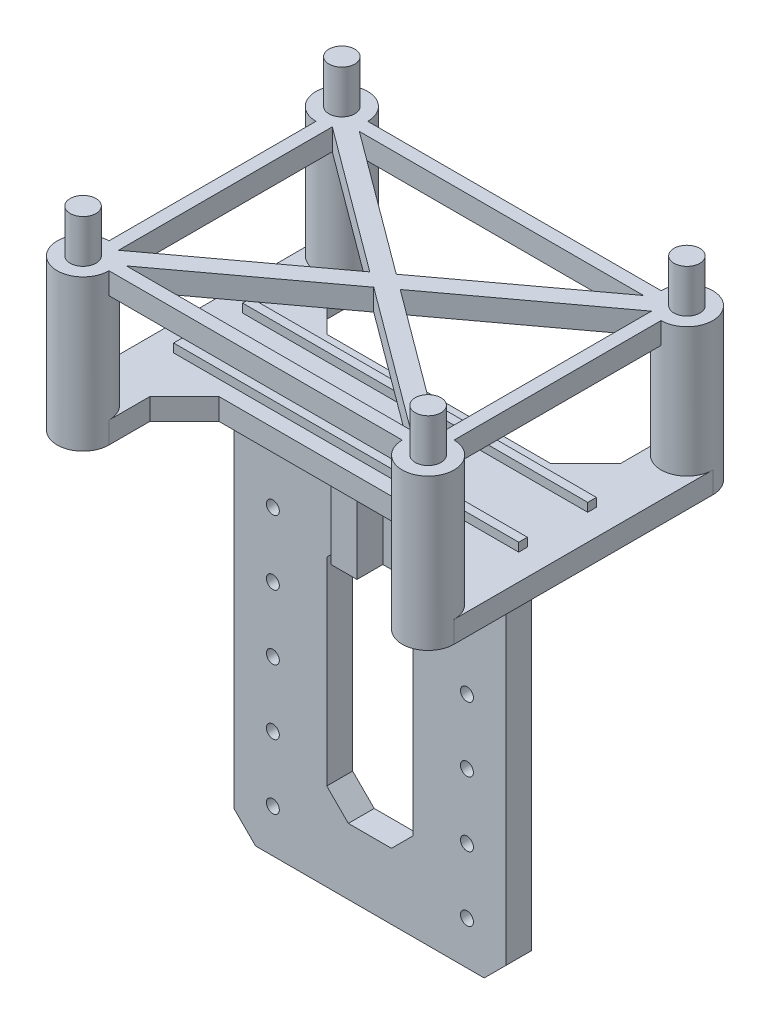
from build123d import *
from build123d.topology import SkipClean

# Parameters (mm, degrees)
SKETCH_1_W          = 87.411285366
SKETCH_1_H          = 25
EXTRUDE_1_DEPTH     = 3
SKETCH_2_R          = 1.5
CUT_EXTRUDE_1_DEPTH = 9
EXTRUDE_3_DEPTH     = 3
SKETCH_4_W          = 12
SKETCH_4_H          = 60
EXTRUDE_4_DEPTH     = 3
EXTRUDE_START       = 30
SKETCH_5_R          = 6
EXTRUDE_5_DEPTH     = 30
SKETCH_7_W          = 80
SKETCH_7_H          = 2
EXTRUDE_7_DEPTH     = 2
SKETCH_8_R          = 3
EXTRUDE_8_DEPTH     = 10
CHAMFER_1_SIZE      = 8
SKETCH_9_W          = 80
SKETCH_9_H          = 60
EXTRUDE_9_DEPTH     = 5
SKETCH_10_R         = 1.5
EXTRUDE_11_DEPTH    = 2
EXTRUDE_START_2     = -5
EXTRUDE_13_DEPTH    = 95
SKETCH_14_R         = 1.5
CUT_EXTRUDE_2_DEPTH = 90
SKETCH_20_W         = 10
SKETCH_20_H         = 55.969935275
CUT_EXTRUDE_3_DEPTH = 111.182802651
CHAMFER_2_SIZE      = 5
EXTRUDE_16_DEPTH    = 6
SKETCH_23_W         = 63
SKETCH_23_H         = 90
CUT_EXTRUDE_4_DEPTH = 1
CHAMFER_3_SIZE      = 5
CHAMFER_4_SIZE      = 5


with BuildPart() as part:
    # 草图1 → 凸台-拉伸1 (new body)
    with BuildSketch(Plane(origin=(0, 0, 0), x_dir=(1, 0, 0), z_dir=(0, 1, 0))):
        Rectangle(SKETCH_1_W, SKETCH_1_H)
    extrude(amount=EXTRUDE_1_DEPTH)

    # 草图2 → 切除-拉伸1 (cut)
    with BuildSketch(Plane.XZ):
        with Locations(Location((30, 0, 0), (0, 0, 270))):
            Circle(SKETCH_2_R)
        with Locations(Location((-30, 0, 0), (0, 0, 270))):
            Circle(SKETCH_2_R)
    extrude(amount=-CUT_EXTRUDE_1_DEPTH, mode=Mode.SUBTRACT)

    # 草图3 → 凸台-拉伸3 (add)
    with BuildSketch(Plane(origin=(0, 3, 0), x_dir=(1, 0, 0), z_dir=(0, 1, 0))):
        with BuildLine():
            Line((-43.705642683, 12.5), (-35.720877619, 12.5))
            Line((-35.720877619, 12.5), (-35.720877619, 25.794157439))
            ThreePointArc((-35.720877619, 25.794157439), (-40.384749305, 35.98765129), (-43.705642683, 25.281079328))
            Line((-43.705642683, 25.281079328), (-43.705642683, 12.5))
        make_face()
        with BuildLine():
            Line((35.720877619, 12.5), (43.705642683, 12.5))
            Line((43.705642683, 12.5), (43.705642683, 25.281079328))
            ThreePointArc((43.705642683, 25.281079328), (40.384749305, 35.98765129), (35.720877619, 25.794157439))
            Line((35.720877619, 25.794157439), (35.720877619, 12.5))
        make_face()
        with BuildLine():
            Line((43.705642683, -25.281079328), (43.705642683, -12.5))
            Line((43.705642683, -12.5), (35.720877619, -12.5))
            Line((35.720877619, -12.5), (35.720877619, -25.794157439))
            ThreePointArc((35.720877619, -25.794157439), (40.384749305, -35.98765129), (43.705642683, -25.281079328))
        make_face()
        with BuildLine():
            Line((-35.720877619, -25.794157439), (-35.720877619, -12.5))
            Line((-35.720877619, -12.5), (-43.705642683, -12.5))
            Line((-43.705642683, -12.5), (-43.705642683, -25.281079328))
            ThreePointArc((-43.705642683, -25.281079328), (-40.384749305, -35.98765129), (-35.720877619, -25.794157439))
        make_face()
    extrude(amount=-EXTRUDE_3_DEPTH)

    # 草图4 → 凸台-拉伸4 (add)
    with BuildSketch(Plane(origin=(0, 3, 0), x_dir=(1, 0, 0), z_dir=(0, 1, 0))):
        with Locations((40, 0)):
            Rectangle(SKETCH_4_W, SKETCH_4_H)
        with Locations((-40, 0)):
            Rectangle(SKETCH_4_W, SKETCH_4_H)
    extrude(amount=-EXTRUDE_4_DEPTH)

    # 草图5 → 凸台-拉伸5 (add)
    with BuildSketch(Plane(origin=(0, 3, 0), x_dir=(1, 0, 0), z_dir=(0, 1, 0)).offset(EXTRUDE_START)):
        with Locations(Location((40, 30, 0), (0, 0, 270))):
            Circle(SKETCH_5_R)
        with Locations(Location((40, -30, 0), (0, 0, 270))):
            Circle(SKETCH_5_R)
        with Locations(Location((-40, -30, 0), (0, 0, 270))):
            Circle(SKETCH_5_R)
        with Locations(Location((-40, 30, 0), (0, 0, 270))):
            Circle(SKETCH_5_R)
    extrude(amount=-EXTRUDE_5_DEPTH)

    # 草图7 → 凸台-拉伸7 (add)
    with BuildSketch(Plane(origin=(0, 3, 0), x_dir=(1, 0, 0), z_dir=(0, 1, 0))):
        with Locations((0, -8)):
            Rectangle(SKETCH_7_W, SKETCH_7_H)
        with Locations((0, 8)):
            Rectangle(SKETCH_7_W, SKETCH_7_H)
    extrude(amount=EXTRUDE_7_DEPTH)

    # 草图8 → 凸台-拉伸8 (add)
    with BuildSketch(Plane(origin=(0, 33, 0), x_dir=(1, 0, 0), z_dir=(0, 1, 0))):
        with Locations(Location((-40, -30, 0), (0, 0, 270))):
            Circle(SKETCH_8_R)
        with Locations(Location((-40, 30, 0), (0, 0, 270))):
            Circle(SKETCH_8_R)
        with Locations(Location((40, 30, 0), (0, 0, 270))):
            Circle(SKETCH_8_R)
        with Locations(Location((40, -30, 0), (0, 0, 270))):
            Circle(SKETCH_8_R)
    extrude(amount=EXTRUDE_8_DEPTH)

    # 倒角1
    chamfer_1_edges = [part.edges().sort_by_distance(p)[0] for p in [
        (-34, 1.5, 12.5),
        (-34, 1.5, -12.5),
        (34, 1.5, 12.5),
        (34, 1.5, -12.5),
    ]]
    chamfer(chamfer_1_edges, length=CHAMFER_1_SIZE)

    # 草图9 → 凸台-拉伸9 (add)
    with BuildSketch(Plane(origin=(0, 33, 0), x_dir=(1, 0, 0), z_dir=(0, 1, 0))):
        Rectangle(SKETCH_9_W, SKETCH_9_H)
        Polygon((32.947368421, 27), (-32.947368421, 27), (0, 2.61038961), align=None, mode=Mode.SUBTRACT)
        Polygon((-37, 24.779220779), (-37, -24.779220779), (-3.526315789, 0), align=None, mode=Mode.SUBTRACT)
        Polygon((-32.947368421, -27), (32.947368421, -27), (0, -2.61038961), align=None, mode=Mode.SUBTRACT)
        Polygon((37, -24.779220779), (37, 24.779220779), (3.526315789, 0), align=None, mode=Mode.SUBTRACT)
    extrude(amount=-EXTRUDE_9_DEPTH)

    # 草图10 → 凸台-拉伸11 (add)
    with BuildSketch(Plane.XZ):
        with BuildLine():
            Line((26, 12.5), (-26, 12.5))
            Line((-26, 12.5), (-34, 20.5))
            Line((-34, 20.5), (-34, 30))
            ThreePointArc((-34, 30), (-40, 36), (-46, 30))
            Line((-46, 30), (-46, -30))
            ThreePointArc((-46, -30), (-40, -36), (-34, -30))
            Line((-34, -30), (-34, -20.5))
            Line((-34, -20.5), (-26, -12.5))
            Line((-26, -12.5), (26, -12.5))
            Line((26, -12.5), (34, -20.5))
            Line((34, -20.5), (34, -30))
            ThreePointArc((34, -30), (40, -36), (46, -30))
            Line((46, -30), (46, 30))
            ThreePointArc((46, 30), (40, 36), (34, 30))
            Line((34, 30), (34, 20.5))
            Line((34, 20.5), (26, 12.5))
        make_face()
        with Locations(Location((-30, 0, 0), (0, 0, 270))):
            Circle(SKETCH_10_R, mode=Mode.SUBTRACT)
        with Locations(Location((30, 0, 0), (0, 0, 270))):
            Circle(SKETCH_10_R, mode=Mode.SUBTRACT)
    extrude(amount=EXTRUDE_11_DEPTH)

    # 草图12 → 凸台-拉伸13 (add)
    with SkipClean():  # the faces are left unmerged after this step: merging them gives an invalid solid
        with BuildSketch(Plane.XZ.offset(2).offset(EXTRUDE_START_2)):
            Polygon((31.5, -3.5), (31.5, 0), (31.5, 3.5), (-31.5, 3.5), (-31.5, -3.5), align=None)
        extrude(amount=EXTRUDE_13_DEPTH)

    # 草图14 → 切除-拉伸2 (cut)
    with SkipClean():  # the faces are left unmerged after this step: merging them gives an invalid solid
        with BuildSketch(Plane(origin=(0, 0, -3.5), x_dir=(-1, 0, 0), z_dir=(0, 0, -1))):
            with Locations((-22.5, -82)):
                Circle(SKETCH_14_R)
            with Locations((22.5, -82)):
                Circle(SKETCH_14_R)
            with Locations((22.5, -67)):
                Circle(SKETCH_14_R)
            with Locations((-22.5, -67)):
                Circle(SKETCH_14_R)
            with Locations((22.5, -52)):
                Circle(SKETCH_14_R)
            with Locations((-22.5, -52)):
                Circle(SKETCH_14_R)
            with Locations((22.5, -37)):
                Circle(SKETCH_14_R)
            with Locations((-22.5, -37)):
                Circle(SKETCH_14_R)
            with Locations((22.5, -22)):
                Circle(SKETCH_14_R)
            with Locations((-22.5, -22)):
                Circle(SKETCH_14_R)
        extrude(amount=-CUT_EXTRUDE_2_DEPTH, mode=Mode.SUBTRACT)

    # 草图20 → 切除-拉伸3 (cut, through all)
    with SkipClean():  # the faces are left unmerged after this step: merging them gives an invalid solid
        with BuildSketch(Plane(origin=(0, 0, -3.5), x_dir=(-1, 0, 0), z_dir=(0, 0, -1))):
            with Locations((-5, -48.723053955)):
                Rectangle(SKETCH_20_W, SKETCH_20_H)
            with Locations((5, -48.723053955)):
                Rectangle(SKETCH_20_W, SKETCH_20_H)
        extrude(amount=-CUT_EXTRUDE_3_DEPTH, mode=Mode.SUBTRACT)

    # 倒角2
    chamfer_2_edges = [part.edges().sort_by_distance(p)[0] for p in [
        (10, -20.738086318, 0),
        (-10, -20.738086318, 0),
        (-10, -76.708021593, 0),
        (10, -76.708021593, 0),
    ]]
    chamfer(chamfer_2_edges, length=CHAMFER_2_SIZE)

    # 草图21 → 凸台-拉伸16 (add)
    with SkipClean():  # the faces are left unmerged after this step: merging them gives an invalid solid
        with BuildSketch(Plane.XY.offset(3.5)):
            Polygon((3, -2), (0, -2), (-3, -2), (-3, -20.738086318), (3, -20.738086318), align=None)
        extrude(amount=EXTRUDE_16_DEPTH)

    # 草图23 → 切除-拉伸4 (cut)
    with SkipClean():  # the faces are left unmerged after this step: merging them gives an invalid solid
        with BuildSketch(Plane(origin=(0, 0, -3.5), x_dir=(-1, 0, 0), z_dir=(0, 0, -1))):
            with Locations((0, -47)):
                Rectangle(SKETCH_23_W, SKETCH_23_H)
        extrude(amount=-CUT_EXTRUDE_4_DEPTH, mode=Mode.SUBTRACT)

    # 倒角3
    # the kernel refuses this chamfer: 5 mm, written as the material it adds along each edge
    with BuildSketch(Plane(origin=(-31.5, -2, 3.7e-08), x_dir=(-0.9996219169112968, 0.02749587661058636, 0), z_dir=(0, 0, 1))) as chamfer_3_piece_1:
        Polygon((CHAMFER_3_SIZE * 0.999621916911, CHAMFER_3_SIZE * 0.0274958766106), (-CHAMFER_3_SIZE * 0.0274958766106, CHAMFER_3_SIZE * 0.999621916911), (0, 0), align=None)
    extrude(amount=3.499999963)
    with BuildSketch(Plane(origin=(-9.85841494, -2, 3.5), x_dir=(0, 0.02749587661058636, 0.9996219169112968), z_dir=(1, 0, 0)), Plane(origin=(-31.5, -2, 3.5), x_dir=(0, 0.02749587661058636, 0.9996219169112968), z_dir=(1, 0, 0))) as chamfer_3_piece_2:
        Polygon((CHAMFER_3_SIZE * 0.999621916911, CHAMFER_3_SIZE * 0.0274958766106), (-CHAMFER_3_SIZE * 0.0274958766106, CHAMFER_3_SIZE * 0.999621916911), (0, 0), align=None)
    extrude(amount=41.35841494)
    with BuildSketch(Plane(origin=(31.5, -2, 3.5), x_dir=(0.9996219169112968, 0.02749587661058636, 0), z_dir=(0, 0, -1))) as chamfer_3_piece_3:
        Polygon((CHAMFER_3_SIZE * 0.999621916911, CHAMFER_3_SIZE * 0.0274958766106), (-CHAMFER_3_SIZE * 0.0274958766106, CHAMFER_3_SIZE * 0.999621916911), (0, 0), align=None)
    extrude(amount=3.500000113)
    with BuildSketch(Plane(origin=(-31.5, -2, -2.5), x_dir=(0, 0.02749587661058636, -0.9996219169112968), z_dir=(1, 0, 0))) as chamfer_3_piece_4:
        Polygon((CHAMFER_3_SIZE * 0.999621916911, -CHAMFER_3_SIZE * 0.0274958766106), (-CHAMFER_3_SIZE * 0.0274958766106, -CHAMFER_3_SIZE * 0.999621916911), (0, 0), align=None)
    extrude(amount=63)
    with BuildSketch(Plane(origin=(31.5, -2, -1.13e-07), x_dir=(0.9996219169112968, 0.02749587661058636, 0), z_dir=(0, 0, -1))) as chamfer_3_piece_5:
        Polygon((CHAMFER_3_SIZE * 0.999621916911, CHAMFER_3_SIZE * 0.0274958766106), (-CHAMFER_3_SIZE * 0.0274958766106, CHAMFER_3_SIZE * 0.999621916911), (0, 0), align=None)
    extrude(amount=2.499999887)
    with BuildSketch(Plane(origin=(-31.5, -2, -2.5), x_dir=(-0.9996219169112968, 0.02749587661058636, 0), z_dir=(0, 0, 1))) as chamfer_3_piece_6:
        Polygon((CHAMFER_3_SIZE * 0.999621916911, CHAMFER_3_SIZE * 0.0274958766106), (-CHAMFER_3_SIZE * 0.0274958766106, CHAMFER_3_SIZE * 0.999621916911), (0, 0), align=None)
    extrude(amount=2.500000037)
    with BuildSketch(Plane(origin=(-44.35841494, -2, 3.5), x_dir=(0, 0.02749587661058636, 0.9996219169112968), z_dir=(1, 0, 0))) as chamfer_3_piece_7a_section:
        Polygon((CHAMFER_3_SIZE * 0.999621916911, CHAMFER_3_SIZE * 0.0274958766106), (-CHAMFER_3_SIZE * 0.0274958766106, CHAMFER_3_SIZE * 0.999621916911), (0, 0), align=None)
    chamfer_3_piece_7a = extrude(amount=41.35841494, mode=Mode.PRIVATE)
    chamfer_3_piece_7a = split(chamfer_3_piece_7a, bisect_by=Plane(origin=(-31.5, -3.648968134, 5.148968134), z_dir=(-1, 0, 0)), keep=Keep.TOP, mode=Mode.PRIVATE)
    with BuildSketch(Plane(origin=(-31.5, -2, 3.7e-08), x_dir=(-0.9996219169112968, 0.02749587661058636, 0), z_dir=(0, 0, 1))) as chamfer_3_piece_7b_section:
        Polygon((CHAMFER_3_SIZE * 0.999621916911, CHAMFER_3_SIZE * 0.0274958766106), (-CHAMFER_3_SIZE * 0.0274958766106, CHAMFER_3_SIZE * 0.999621916911), (0, 0), align=None)
    chamfer_3_piece_7b = extrude(amount=16.358414903, mode=Mode.PRIVATE)
    chamfer_3_piece_7b = split(chamfer_3_piece_7b, bisect_by=Plane(origin=(-33.148968134, -3.648968134, 3.5), z_dir=(0, 0, 1)), keep=Keep.TOP, mode=Mode.PRIVATE)
    chamfer_3_piece_7 = chamfer_3_piece_7a & chamfer_3_piece_7b
    add(chamfer_3_piece_7)
    with BuildSketch(Plane(origin=(31.5, -2, 16.35841494), x_dir=(0.9996219169112968, 0.02749587661058636, 0), z_dir=(0, 0, -1))) as chamfer_3_piece_8a_section:
        Polygon((CHAMFER_3_SIZE * 0.999621916911, CHAMFER_3_SIZE * 0.0274958766106), (-CHAMFER_3_SIZE * 0.0274958766106, CHAMFER_3_SIZE * 0.999621916911), (0, 0), align=None)
    chamfer_3_piece_8a = extrude(amount=16.358415053, mode=Mode.PRIVATE)
    chamfer_3_piece_8a = split(chamfer_3_piece_8a, bisect_by=Plane(origin=(33.148968134, -3.648968134, 3.5), z_dir=(0, 0, 1)), keep=Keep.TOP, mode=Mode.PRIVATE)
    with BuildSketch(Plane(origin=(3, -2, 3.5), x_dir=(0, 0.02749587661058636, 0.9996219169112968), z_dir=(1, 0, 0))) as chamfer_3_piece_8b_section:
        Polygon((CHAMFER_3_SIZE * 0.999621916911, CHAMFER_3_SIZE * 0.0274958766106), (-CHAMFER_3_SIZE * 0.0274958766106, CHAMFER_3_SIZE * 0.999621916911), (0, 0), align=None)
    chamfer_3_piece_8b = extrude(amount=41.35841494, mode=Mode.PRIVATE)
    chamfer_3_piece_8b = split(chamfer_3_piece_8b, bisect_by=Plane(origin=(31.5, -3.648968134, 5.148968134), z_dir=(1, 0, 0)), keep=Keep.TOP, mode=Mode.PRIVATE)
    chamfer_3_piece_8 = chamfer_3_piece_8a & chamfer_3_piece_8b
    add(chamfer_3_piece_8)
    with BuildSketch(Plane(origin=(-31.5, -2, -15.35841494), x_dir=(-0.9996219169112968, 0.02749587661058636, 0), z_dir=(0, 0, 1))) as chamfer_3_piece_9a_section:
        Polygon((CHAMFER_3_SIZE * 0.999621916911, CHAMFER_3_SIZE * 0.0274958766106), (-CHAMFER_3_SIZE * 0.0274958766106, CHAMFER_3_SIZE * 0.999621916911), (0, 0), align=None)
    chamfer_3_piece_9a = extrude(amount=15.358414976, mode=Mode.PRIVATE)
    chamfer_3_piece_9a = split(chamfer_3_piece_9a, bisect_by=Plane(origin=(-33.148968134, -3.648968134, -2.5), z_dir=(0, 0, -1)), keep=Keep.TOP, mode=Mode.PRIVATE)
    with BuildSketch(Plane(origin=(-44.35841494, -2, -2.5), x_dir=(0, 0.02749587661058636, -0.9996219169112968), z_dir=(1, 0, 0))) as chamfer_3_piece_9b_section:
        Polygon((CHAMFER_3_SIZE * 0.999621916911, -CHAMFER_3_SIZE * 0.0274958766106), (-CHAMFER_3_SIZE * 0.0274958766106, -CHAMFER_3_SIZE * 0.999621916911), (0, 0), align=None)
    chamfer_3_piece_9b = extrude(amount=75.85841494, mode=Mode.PRIVATE)
    chamfer_3_piece_9b = split(chamfer_3_piece_9b, bisect_by=Plane(origin=(-31.5, -3.648968134, -4.148968134), z_dir=(-1, 0, 0)), keep=Keep.TOP, mode=Mode.PRIVATE)
    chamfer_3_piece_9 = chamfer_3_piece_9a & chamfer_3_piece_9b
    add(chamfer_3_piece_9)
    with BuildSketch(Plane(origin=(31.5, -2, -1.13e-07), x_dir=(0.9996219169112968, 0.02749587661058636, 0), z_dir=(0, 0, -1))) as chamfer_3_piece_10a_section:
        Polygon((CHAMFER_3_SIZE * 0.999621916911, CHAMFER_3_SIZE * 0.0274958766106), (-CHAMFER_3_SIZE * 0.0274958766106, CHAMFER_3_SIZE * 0.999621916911), (0, 0), align=None)
    chamfer_3_piece_10a = extrude(amount=15.358414826, mode=Mode.PRIVATE)
    chamfer_3_piece_10a = split(chamfer_3_piece_10a, bisect_by=Plane(origin=(33.148968134, -3.648968134, -2.5), z_dir=(0, 0, -1)), keep=Keep.TOP, mode=Mode.PRIVATE)
    with BuildSketch(Plane(origin=(-31.5, -2, -2.5), x_dir=(0, 0.02749587661058636, -0.9996219169112968), z_dir=(1, 0, 0))) as chamfer_3_piece_10b_section:
        Polygon((CHAMFER_3_SIZE * 0.999621916911, -CHAMFER_3_SIZE * 0.0274958766106), (-CHAMFER_3_SIZE * 0.0274958766106, -CHAMFER_3_SIZE * 0.999621916911), (0, 0), align=None)
    chamfer_3_piece_10b = extrude(amount=75.85841494, mode=Mode.PRIVATE)
    chamfer_3_piece_10b = split(chamfer_3_piece_10b, bisect_by=Plane(origin=(31.5, -3.648968134, -4.148968134), z_dir=(1, 0, 0)), keep=Keep.TOP, mode=Mode.PRIVATE)
    chamfer_3_piece_10 = chamfer_3_piece_10a & chamfer_3_piece_10b
    add(chamfer_3_piece_10)

    # 倒角4
    chamfer_4_edges = [part.edges().sort_by_distance(p)[0] for p in [
        (-31.5, -92, 0.5),
        (31.5, -92, 0.5),
    ]]
    chamfer(chamfer_4_edges, length=CHAMFER_4_SIZE)


solid = part.part
